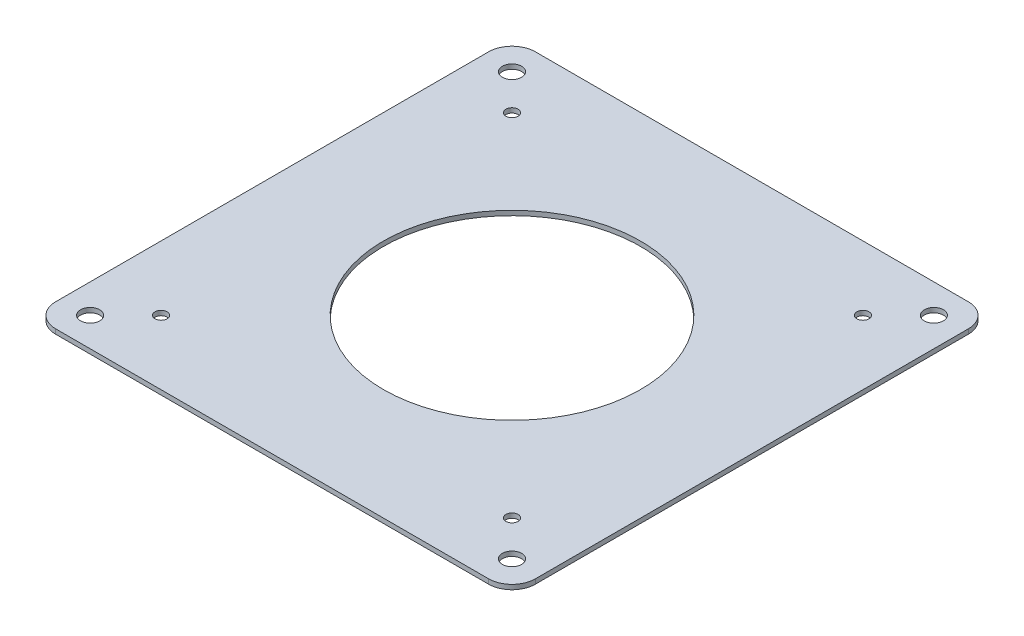
from build123d import *

# Parameters (mm, degrees)
BASE_FLANGE1_DEPTH = 1
SKETCH6_R          = 27.45
CUT_EXTRUDE1_DEPTH = 10
SKETCH8_R          = 2.05
SKETCH8_R_2        = 1.3
CUT_EXTRUDE3_DEPTH = 10
CIRPATTERN2_COUNT  = 4


# Sheet-metal steps are written as plain solids
with BuildPart() as part:
    # Sketch1 → Base-Flange1 (new body)
    with BuildSketch(Plane(origin=(0, 0, 0), x_dir=(1, 0, 0), z_dir=(0, 1, 0))):
        with BuildLine():
            Line((-46.2, -51.2), (46.2, -51.2))
            ThreePointArc((46.2, -51.2), (49.735533906, -49.735533906), (51.2, -46.2))
            Line((51.2, -46.2), (51.2, 46.2))
            ThreePointArc((51.2, 46.2), (49.735533906, 49.735533906), (46.2, 51.2))
            Line((46.2, 51.2), (-46.2, 51.2))
            ThreePointArc((-46.2, 51.2), (-49.735533906, 49.735533906), (-51.2, 46.2))
            Line((-51.2, 46.2), (-51.2, -46.2))
            ThreePointArc((-51.2, -46.2), (-49.735533906, -49.735533906), (-46.2, -51.2))
        make_face()
    extrude(amount=-BASE_FLANGE1_DEPTH)

    # Sketch6 → Cut-Extrude1 (cut)
    with BuildSketch(Plane(origin=(0, 0, 0), x_dir=(1, 0, 0), z_dir=(0, 1, 0))):
        with Locations(Location((0, 0, 0), (0, 0, 270))):
            Circle(SKETCH6_R)
    extrude(amount=-CUT_EXTRUDE1_DEPTH, mode=Mode.SUBTRACT)

    # Sketch8 → Cut-Extrude3 (cut)
    with BuildSketch(Plane(origin=(0, 0, 0), x_dir=(1, 0, 0), z_dir=(0, 1, 0))):
        with Locations(Location((45.02, 45.02, 0), (0, 0, 270))):
            Circle(SKETCH8_R)
        with Locations(Location((37.45, 37.45, 0), (0, 0, 270))):
            Circle(SKETCH8_R_2)
    cut_extrude3 = extrude(amount=-CUT_EXTRUDE3_DEPTH, mode=Mode.SUBTRACT)

    # CirPattern2: Cut-Extrude3 ×4 about axis
    cirpattern2_axis = Axis((0, 0, 0), (0, 1, 0))
    for i in range(1, CIRPATTERN2_COUNT):
        add(cut_extrude3.rotate(cirpattern2_axis, i * 360 / CIRPATTERN2_COUNT), mode=Mode.SUBTRACT)


solid = part.part
